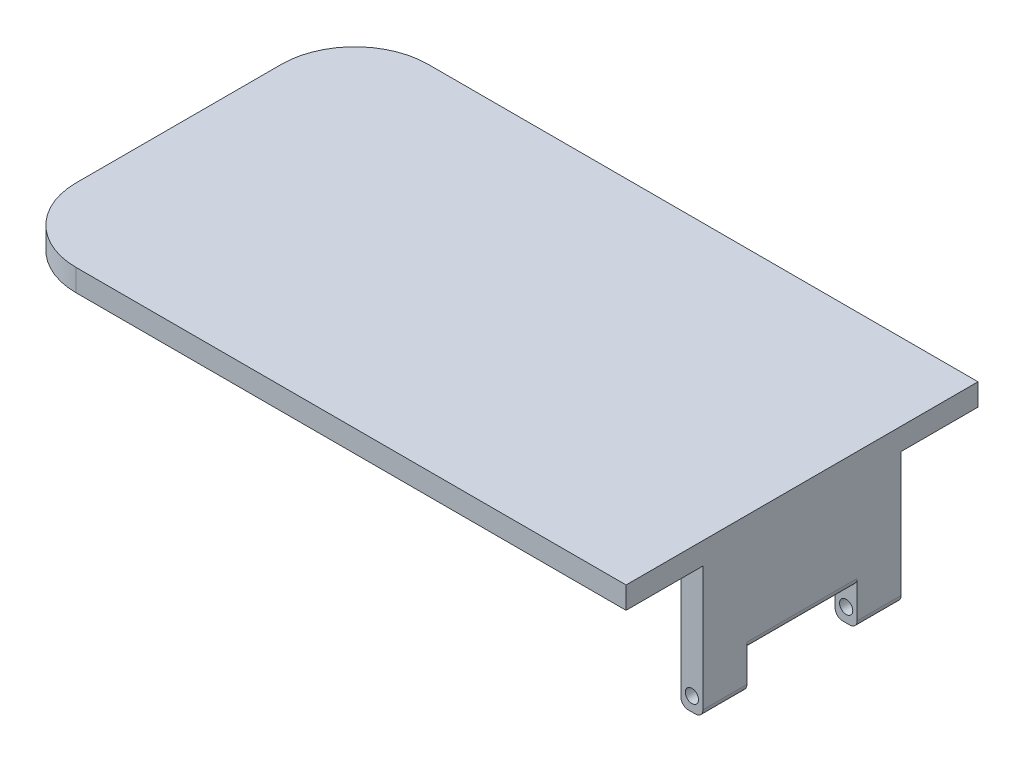
from build123d import *

# Parameters (mm, degrees)
SKETCH1_W                  = 85
SKETCH1_H                  = 48
BOSS_EXTRUDE1_DEPTH        = 3
SKETCH2_W                  = 3
SKETCH2_H                  = 48
BOSS_EXTRUDE2_DEPTH        = 18
M1_6_CLEARANCE_HOLE2_D     = 1.8
SKETCH11_W                 = 15.04
SKETCH11_H                 = 5
CUT_EXTRUDE5_DEPTH         = 91.785461391
SKETCH14_W                 = 10.48
SKETCH14_H                 = 18
CUT_EXTRUDE6_DEPTH         = 88.982952894
FILLET1_R                  = 1
FILLET2_R                  = 1
FILLET3_R                  = 1
FILLET4_R                  = 1
FILLET5_R                  = 1
FILLET6_R                  = 1
SKETCH17_R                 = 23
CUT_EXTRUDE11_DEPTH        = 1
FILLET9_R                  = 1
FILLET10_R                 = 10
FILLET11_R                 = 10
SKETCH18_W                 = 6
SKETCH18_H                 = 4.397787755
SKETCH18_H_2               = 4.357175314
BOSS_EXTRUDE3_DEPTH        = 4
F_1_5_1_5_DIAMETER_HOLE1_D = 1.5


with BuildPart() as part:
    # Sketch1 → Boss-Extrude1 (new body)
    with BuildSketch(Plane(origin=(0, 0, 0), x_dir=(1, 0, 0), z_dir=(0, 1, 0))):
        Rectangle(SKETCH1_W, SKETCH1_H)
    extrude(amount=-BOSS_EXTRUDE1_DEPTH)

    # Sketch2 → Boss-Extrude2 (add)
    with BuildSketch(Plane.XZ.offset(3)):
        with Locations((41, 0)):
            Rectangle(SKETCH2_W, SKETCH2_H)
    extrude(amount=BOSS_EXTRUDE2_DEPTH)

    # M1.6 Clearance Hole2 (through all)
    with Locations(Plane(origin=(0, 0, -24), x_dir=(-1, 0, 0), z_dir=(0, 0, -1))):
        with Locations((-41, -19.1)):
            Hole(M1_6_CLEARANCE_HOLE2_D / 2)

    # Sketch11 → Cut-Extrude5 (cut, through all)
    with BuildSketch(Plane(origin=(42.5, 0, 0), x_dir=(0, 0, -1), z_dir=(1, 0, 0))):
        with Locations((0, -18.5)):
            Rectangle(SKETCH11_W, SKETCH11_H)
    extrude(amount=-CUT_EXTRUDE5_DEPTH, mode=Mode.SUBTRACT)

    # Sketch14 → Cut-Extrude6 (cut, through all)
    with BuildSketch(Plane.ZY.offset(-39.5)):
        with Locations((-18.76, -12)):
            Rectangle(SKETCH14_W, SKETCH14_H)
        with Locations((18.76, -12)):
            Rectangle(SKETCH14_W, SKETCH14_H)
    extrude(amount=-CUT_EXTRUDE6_DEPTH, mode=Mode.SUBTRACT)

    # Fillet1
    fillet1_edges = [part.edges().sort_by_distance(p)[0] for p in [
        (42.5, -21, -10.52),
    ]]
    fillet(fillet1_edges, radius=FILLET1_R)

    # Fillet2
    fillet2_edges = [part.edges().sort_by_distance(p)[0] for p in [
        (42.5, -21, 10.52),
    ]]
    fillet(fillet2_edges, radius=FILLET2_R)

    # Fillet3
    fillet3_edges = [part.edges().sort_by_distance(p)[0] for p in [
        (39.5, -21, -10.52),
    ]]
    fillet(fillet3_edges, radius=FILLET3_R)

    # Fillet4
    fillet4_edges = [part.edges().sort_by_distance(p)[0] for p in [
        (39.5, -21, 10.52),
    ]]
    fillet(fillet4_edges, radius=FILLET4_R)

    # Fillet5
    fillet5_edges = [part.edges().sort_by_distance(p)[0] for p in [
        (42.5, -16, 0),
    ]]
    fillet(fillet5_edges, radius=FILLET5_R)

    # Fillet6
    fillet6_edges = [part.edges().sort_by_distance(p)[0] for p in [
        (39.5, -16, 0),
    ]]
    fillet(fillet6_edges, radius=FILLET6_R)

    # Sketch17 → Cut-Extrude11 (cut)
    with BuildSketch(Plane.XZ.offset(3)):
        with Locations(Location((2.21, 0, 0), (0, 0, 270))):
            Circle(SKETCH17_R)
    extrude(amount=-CUT_EXTRUDE11_DEPTH, mode=Mode.SUBTRACT)

    # Fillet9
    fillet9_edges = [part.edges().sort_by_distance(p)[0] for p in [
        (2.21, -3, 23),
    ]]
    fillet(fillet9_edges, radius=FILLET9_R - 0.0001)  # a hair under: the kernel refuses the full size

    # Fillet10
    fillet10_edges = [part.edges().sort_by_distance(p)[0] for p in [
        (-42.5, -1.5, -24),
    ]]
    fillet(fillet10_edges, radius=FILLET10_R)

    # Fillet11
    fillet11_edges = [part.edges().sort_by_distance(p)[0] for p in [
        (-42.5, -1.5, 24),
    ]]
    fillet(fillet11_edges, radius=FILLET11_R)

    # Sketch18 → Boss-Extrude3 (add)
    with BuildSketch(Plane.XZ.offset(3)):
        with Locations((-25.5, -4.698893877)):
            Rectangle(SKETCH18_W, SKETCH18_H)
        with Locations((-25.5, 4.678587657)):
            Rectangle(SKETCH18_W, SKETCH18_H_2)
    extrude(amount=BOSS_EXTRUDE3_DEPTH)

    # Ø1.5 (1.5) Diameter Hole1 (through all)
    with Locations(Plane.XY.offset(6.857175314)):
        with Locations((-25.5, -5)):
            Hole(F_1_5_1_5_DIAMETER_HOLE1_D / 2)


solid = part.part
